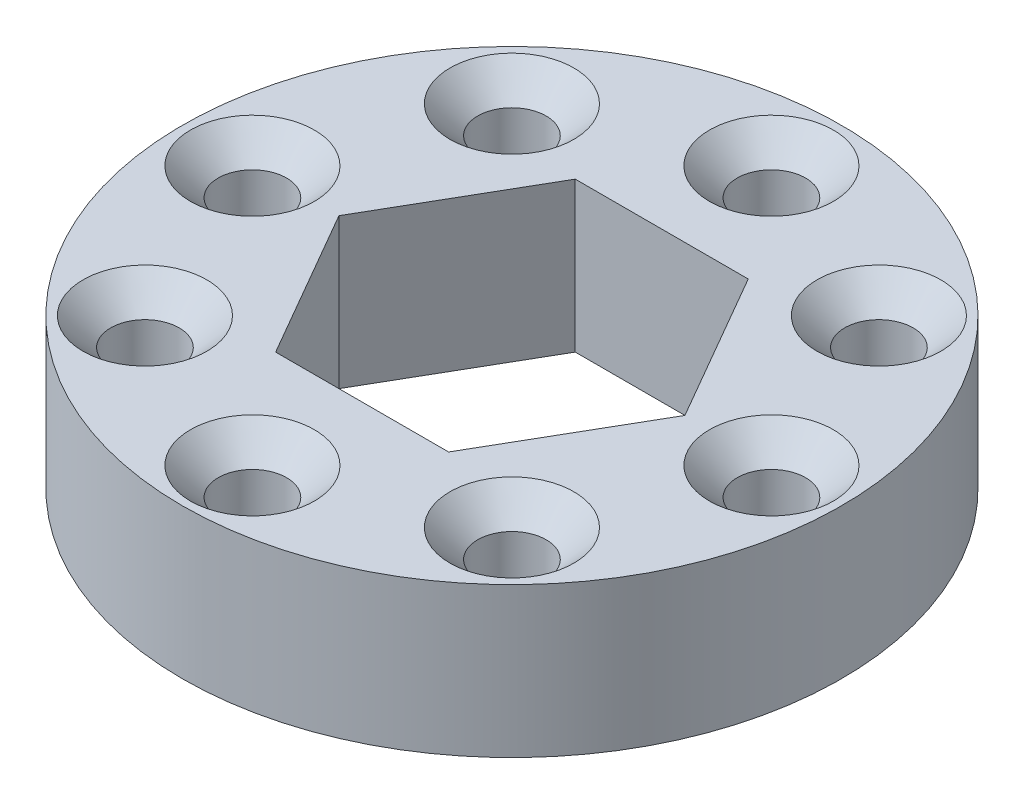
from build123d import *

# Parameters (mm, degrees)
SKETCH1_R                        = 13.97
BOSS_EXTRUDE1_DEPTH              = 3.175
M2_5_CLEARANCE_HOLE1_D           = 2.9
M2_5_CLEARANCE_HOLE1_CSINK_D     = 5.25
M2_5_CLEARANCE_HOLE1_CSINK_ANGLE = 90
CIRPATTERN1_COUNT                = 8


with BuildPart() as part:
    # Sketch1 → Boss-Extrude1 (new, symmetric)
    with BuildSketch(Plane(origin=(0, 0, 0), x_dir=(1, 0, 0), z_dir=(0, 1, 0))):
        Circle(SKETCH1_R)
        Polygon((3.666174209, 6.35), (-3.666174209, 6.35), (-7.332348419, 0), (-3.666174209, -6.35), (3.666174209, -6.35), (7.332348419, 0), align=None, mode=Mode.SUBTRACT)
    extrude(amount=BOSS_EXTRUDE1_DEPTH, both=True)

    # M2.5 Clearance Hole1 (through all)
    with Locations(Plane(origin=(0, 3.175, 0), x_dir=(1, 0, 0), z_dir=(0, 1, 0))):
        with Locations((0, 11)):
            m2_5_clearance_hole1 = CounterSinkHole(M2_5_CLEARANCE_HOLE1_D / 2, M2_5_CLEARANCE_HOLE1_CSINK_D / 2, counter_sink_angle=M2_5_CLEARANCE_HOLE1_CSINK_ANGLE)

    # CirPattern1: M2.5 Clearance Hole1 ×8 about axis
    cirpattern1_axis = Axis((0, 3.175, 0), (0, 1, 0))
    for i in range(1, CIRPATTERN1_COUNT):
        add(m2_5_clearance_hole1.rotate(cirpattern1_axis, i * 360 / CIRPATTERN1_COUNT), mode=Mode.SUBTRACT)


solid = part.part
